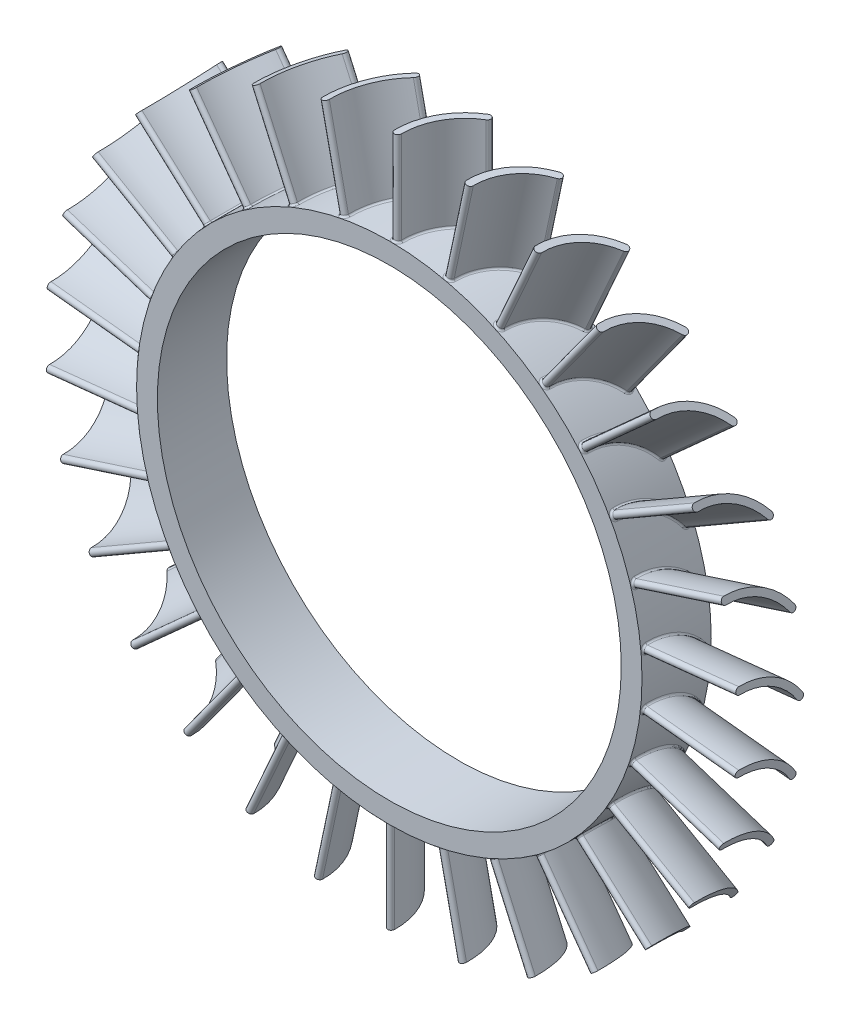
from build123d import *

# Parameters (mm, degrees)
SKETCH1_R                = 73
SKETCH1_R_2              = 67
BOSS_EXTRUDE1_DEPTH      = 10
BOSS_EXTRUDE2_START      = 68
BOSS_EXTRUDE2_DEPTH      = 32
FILLET1_R                = 0.5
CIRPATTERN1_COUNT        = 30
FILLET1_OF_CIRPATTERN1_R = 0.5


with BuildPart() as part:
    # Sketch1 → Boss-Extrude1 (new, symmetric)
    with BuildSketch(Plane.XY):
        Circle(SKETCH1_R)
        Circle(SKETCH1_R_2, mode=Mode.SUBTRACT)
    extrude(amount=BOSS_EXTRUDE1_DEPTH, both=True)

    # Sketch2 → Boss-Extrude2 (add)
    with BuildSketch(Plane(origin=(0, 0, 0), x_dir=(1, 0, 0), z_dir=(0, 1, 0)).offset(BOSS_EXTRUDE2_START)):
        with BuildLine():
            ThreePointArc((-0.015411203, -8.5), (2.48026862, 1.546814045), (9.664759511, 9))
            ThreePointArc((9.664759511, 9), (11.037278052, 8.659129273), (10.696407325, 7.286610731))
            ThreePointArc((10.696407325, 7.286610731), (4.230365523, 0.578743372), (1.984253683, -8.463389269))
            ThreePointArc((1.984253683, -8.463389269), (1.002726606, -9.481527077), (-0.015411203, -8.5))
        make_face()
    boss_extrude2 = extrude(amount=BOSS_EXTRUDE2_DEPTH)

    # Fillet1
    fillet1_edges = [part.edges().sort_by_distance(p)[0] for p in [
        (2.485414926, 72.957677557, -1.556111808),
        (2.485414926, 72.957677557, -1.556111808),
        (4.2367874, 72.876948583, -0.59034287),
        (1.002786497, 72.993112136, 9.481525977),
    ]]
    fillet(fillet1_edges, radius=FILLET1_R)

    # CirPattern1: Boss-Extrude2 ×30 about axis
    cirpattern1_axis = Axis((0, 0, 10), (0, 0, -1))
    for i in range(1, CIRPATTERN1_COUNT):
        add(boss_extrude2.rotate(cirpattern1_axis, i * 360 / CIRPATTERN1_COUNT))

    # Fillet1 of CirPattern1
    fillet1_of_cirpattern1_edges = [part.edges().sort_by_distance(p)[0] for p in [
        (17.599856746, 70.846630438, -1.556111808),
        (17.599856746, 70.846630438, -1.556111808),
        (19.296173031, 70.403534774, -0.59034287),
        (16.156994568, 71.18954647, 9.481525977),
        (31.945100372, 65.639245609, -1.556111808),
        (31.945100372, 65.639245609, -1.556111808),
        (33.512223308, 64.853148661, -0.59034287),
        (30.605064447, 66.274656017, 9.481525977),
        (44.894189823, 57.563110774, -1.556111808),
        (44.894189823, 57.563110774, -1.556111808),
        (46.263628617, 56.468368751, -0.59034287),
        (43.71554615, 58.463245076, 9.481525977),
        (55.881187752, 46.971191781, -1.556111808),
        (55.881187752, 46.971191781, -1.556111808),
        (56.993091358, 45.615650162, -0.59034287),
        (54.915448716, 48.096709787, 9.481525977),
        (64.425909628, 34.326406314, -1.556111808),
        (64.425909628, 34.326406314, -1.556111808),
        (65.231682523, 32.769308773, -0.59034287),
        (63.71528266, 35.628117487, 9.481525977),
        (70.154910104, 20.181392174, -1.556111808),
        (70.154910104, 20.181392174, -1.556111808),
        (70.619336146, 18.490791346, -0.59034287),
        (69.730453011, 21.60240549, 9.481525977),
        (72.817804368, 5.154354356, -1.556111808),
        (72.817804368, 5.154354356, -1.556111808),
        (72.92058591, 3.404137608, -0.59034287),
        (72.698067962, 6.632564713, 9.481525977),
        (72.298211163, -10.097953481, -1.556111808),
        (72.298211163, -10.097953481, -1.556111808),
        (72.034856158, -11.831293278, -0.59034287),
        (72.488428499, -8.627150968, 9.481525977),
        (68.618839204, -24.908932296, -1.556111808),
        (68.618839204, -24.908932296, -1.556111808),
        (68.00085753, -26.549639875, -0.59034287),
        (69.110696872, -23.509818755, 9.481525977),
        (61.940494702, -38.631271243, -1.556111808),
        (61.940494702, -38.631271243, -1.556111808),
        (60.994895124, -40.10763981, -0.59034287),
        (62.712496163, -37.364994649, 9.481525977),
        (52.555053359, -50.665238264, -1.556111808),
        (52.555053359, -50.665238264, -1.556111808),
        (51.323163115, -51.912743428, -0.59034287),
        (53.573458443, -49.58714098, 9.481525977),
        (40.872703996, -60.484891253, -1.556111808),
        (40.872703996, -60.484891253, -1.556111808),
        (39.408362602, -61.449011053, -0.59034287),
        (42.093003515, -59.642091305, 9.481525977),
        (27.40402134, -67.661064256, -1.556111808),
        (27.40402134, -67.661064256, -1.556111808),
        (25.771227541, -68.299662029, -0.59034287),
        (28.772882348, -67.090396045, 9.481525977),
        (12.737651452, -71.880124077, -1.556111808),
        (12.737651452, -71.880124077, -1.556111808),
        (11.007766172, -72.165290037, -0.59034287),
        (14.195248156, -71.606528542, 9.481525977),
        (-2.485414926, -72.957677557, -1.556111808),
        (-2.485414926, -72.957677557, -1.556111808),
        (-4.2367874, -72.876948583, -0.59034287),
        (-1.002786497, -72.993112136, 9.481525977),
        (-17.599856746, -70.846630438, -1.556111808),
        (-17.599856746, -70.846630438, -1.556111808),
        (-19.296173031, -70.403534774, -0.59034287),
        (-16.156994568, -71.18954647, 9.481525977),
        (-31.945100372, -65.639245609, -1.556111808),
        (-31.945100372, -65.639245609, -1.556111808),
        (-33.512223308, -64.853148661, -0.59034287),
        (-30.605064447, -66.274656017, 9.481525977),
        (-44.894189823, -57.563110774, -1.556111808),
        (-44.894189823, -57.563110774, -1.556111808),
        (-46.263628617, -56.468368751, -0.59034287),
        (-43.71554615, -58.463245076, 9.481525977),
        (-55.881187752, -46.971191781, -1.556111808),
        (-55.881187752, -46.971191781, -1.556111808),
        (-56.993091358, -45.615650162, -0.59034287),
        (-54.915448716, -48.096709787, 9.481525977),
        (-64.425909628, -34.326406314, -1.556111808),
        (-64.425909628, -34.326406314, -1.556111808),
        (-65.231682523, -32.769308773, -0.59034287),
        (-63.71528266, -35.628117487, 9.481525977),
        (-70.154910104, -20.181392174, -1.556111808),
        (-70.154910104, -20.181392174, -1.556111808),
        (-70.619336146, -18.490791346, -0.59034287),
        (-69.730453011, -21.60240549, 9.481525977),
        (-72.817804368, -5.154354356, -1.556111808),
        (-72.817804368, -5.154354356, -1.556111808),
        (-72.92058591, -3.404137608, -0.59034287),
        (-72.698067962, -6.632564713, 9.481525977),
        (-72.298211163, 10.097953481, -1.556111808),
        (-72.298211163, 10.097953481, -1.556111808),
        (-72.034856158, 11.831293278, -0.59034287),
        (-72.488428499, 8.627150968, 9.481525977),
        (-68.618839204, 24.908932296, -1.556111808),
        (-68.618839204, 24.908932296, -1.556111808),
        (-68.00085753, 26.549639875, -0.59034287),
        (-69.110696872, 23.509818755, 9.481525977),
        (-61.940494702, 38.631271243, -1.556111808),
        (-61.940494702, 38.631271243, -1.556111808),
        (-60.994895124, 40.10763981, -0.59034287),
        (-62.712496163, 37.364994649, 9.481525977),
        (-52.555053359, 50.665238264, -1.556111808),
        (-52.555053359, 50.665238264, -1.556111808),
        (-51.323163115, 51.912743428, -0.59034287),
        (-53.573458443, 49.58714098, 9.481525977),
        (-40.872703996, 60.484891253, -1.556111808),
        (-40.872703996, 60.484891253, -1.556111808),
        (-39.408362602, 61.449011053, -0.59034287),
        (-42.093003515, 59.642091305, 9.481525977),
        (-27.40402134, 67.661064256, -1.556111808),
        (-27.40402134, 67.661064256, -1.556111808),
        (-25.771227541, 68.299662029, -0.59034287),
        (-28.772882348, 67.090396045, 9.481525977),
        (-12.737651452, 71.880124077, -1.556111808),
        (-12.737651452, 71.880124077, -1.556111808),
        (-11.007766172, 72.165290037, -0.59034287),
        (-14.195248156, 71.606528542, 9.481525977),
    ]]
    fillet(fillet1_of_cirpattern1_edges, radius=FILLET1_OF_CIRPATTERN1_R)


solid = part.part
